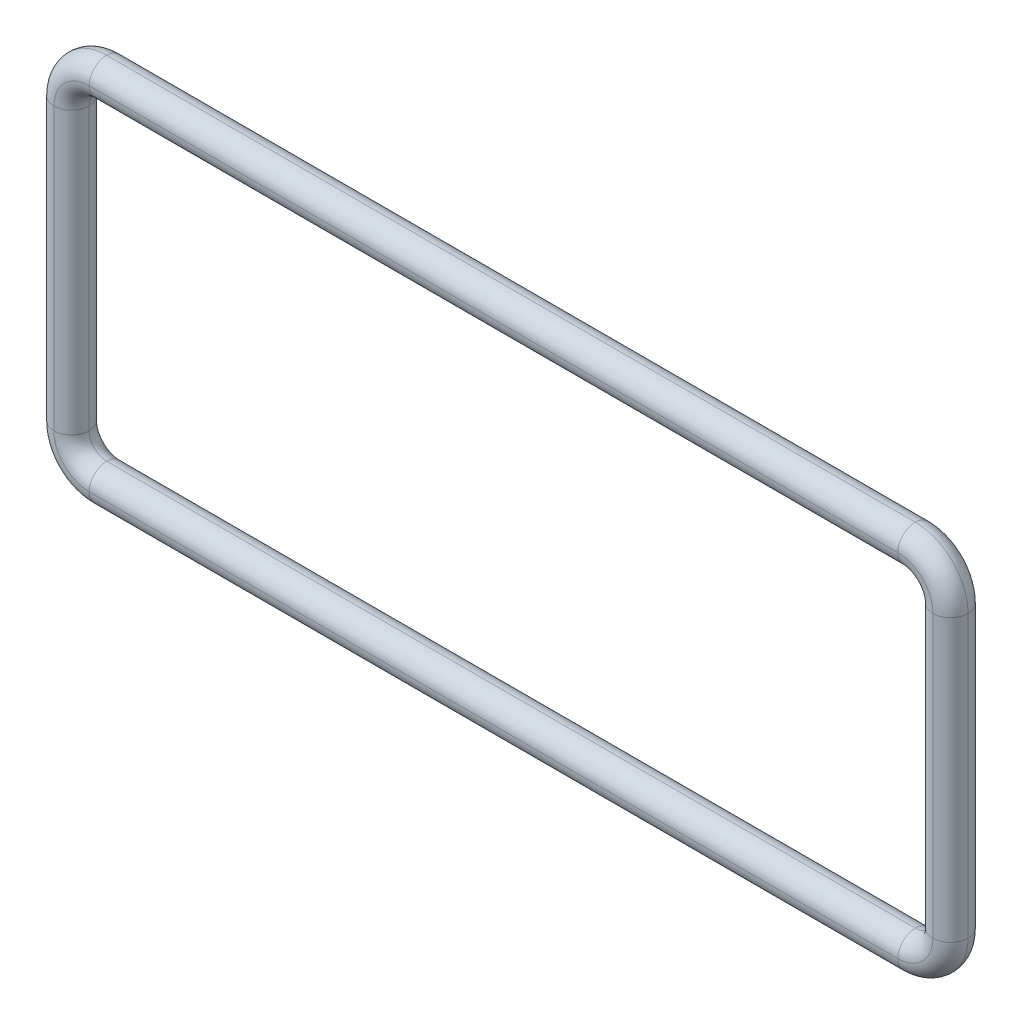
from build123d import *

# Parameters (mm, degrees)
BOSS_EXTRUDE1_DEPTH = 4
FILLET1_R           = 2
FILLET2_R           = 2


with BuildPart() as part:
    # Sketch1 → Boss-Extrude1 (new body)
    with BuildSketch(Plane.XY):
        with BuildLine():
            Line((54, 18), (54, -14))
            ThreePointArc((54, -14), (52.242640687, -18.242640687), (48, -20))
            Line((48, -20), (-44, -20))
            ThreePointArc((-44, -20), (-48.242640687, -18.242640687), (-50, -14))
            Line((-50, -14), (-50, 18))
            ThreePointArc((-50, 18), (-48.242640687, 22.242640687), (-44, 24))
            Line((-44, 24), (48, 24))
            ThreePointArc((48, 24), (52.242640687, 22.242640687), (54, 18))
        make_face()
        with BuildLine():
            Line((50, 18), (50, -14))
            ThreePointArc((50, -14), (49.414213562, -15.414213562), (48, -16))
            Line((48, -16), (-44, -16))
            ThreePointArc((-44, -16), (-45.414213562, -15.414213562), (-46, -14))
            Line((-46, -14), (-46, 18))
            ThreePointArc((-46, 18), (-45.414213562, 19.414213562), (-44, 20))
            Line((-44, 20), (48, 20))
            ThreePointArc((48, 20), (49.414213562, 19.414213562), (50, 18))
        make_face(mode=Mode.SUBTRACT)
    extrude(amount=BOSS_EXTRUDE1_DEPTH)

    # Fillet1
    fillet1_edges = [part.edges().sort_by_distance(p)[0] for p in [
        (-48.242640687, 22.242640687, 4),
        (-50, 2, 4),
        (-48.242640687, -18.242640687, 4),
        (2, -20, 4),
        (52.242640687, -18.242640687, 4),
        (-45.414213562, 19.414213562, 4),
        (-46, 2, 4),
        (-45.414213562, -15.414213562, 4),
        (2, -16, 4),
        (49.414213562, -15.414213562, 4),
        (50, 2, 4),
        (49.414213562, 19.414213562, 4),
        (54, 2, 4),
        (2, 20, 4),
        (52.242640687, 22.242640687, 4),
        (2, 24, 4),
    ]]
    fillet(fillet1_edges, radius=FILLET1_R - 0.0001)  # a hair under: the kernel refuses the full size

    # Fillet2
    fillet2_edges = [part.edges().sort_by_distance(p)[0] for p in [
        (49.414213562, 19.414213562, 0),
        (50, 2, 0),
        (49.414213562, -15.414213562, 0),
        (2, -16, 0),
        (-45.414213562, -15.414213562, 0),
        (-46, 2, 0),
        (-45.414213562, 19.414213562, 0),
        (2, 20, 0),
        (2, 24, 0),
        (-48.242640687, 22.242640687, 0),
        (-50, 2, 0),
        (-48.242640687, -18.242640687, 0),
        (2, -20, 0),
        (52.242640687, -18.242640687, 0),
        (54, 2, 0),
        (52.242640687, 22.242640687, 0),
    ]]
    fillet(fillet2_edges, radius=FILLET2_R - 0.0001)  # a hair under: the kernel refuses the full size


solid = part.part
